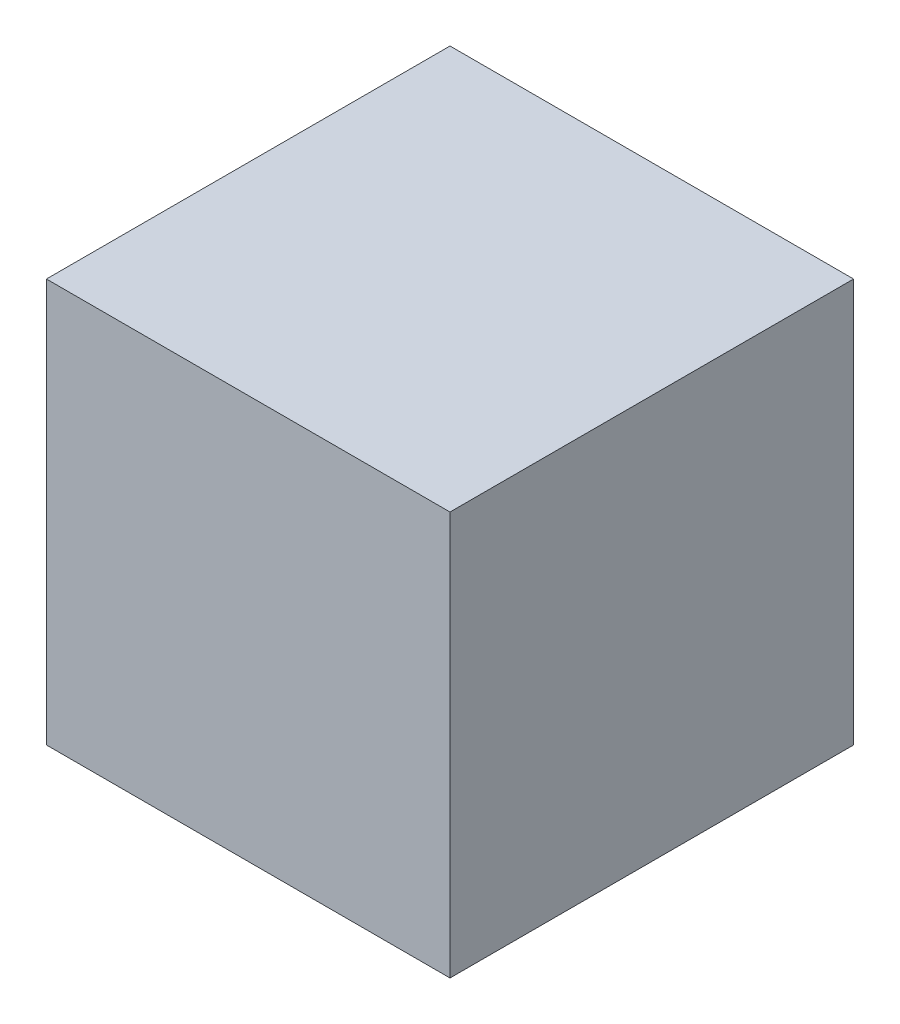
from build123d import *

# Parameters (mm, degrees)
ESBO_O1_W                = 100
ESBO_O1_H                = 100
RESSALTO_EXTRUS_O1_DEPTH = 100


with BuildPart() as part:
    # Esboço1 → Ressalto-extrusão1 (new body)
    with BuildSketch(Plane.XY):
        with Locations((50, 50)):
            Rectangle(ESBO_O1_W, ESBO_O1_H)
    extrude(amount=RESSALTO_EXTRUS_O1_DEPTH)


solid = part.part
